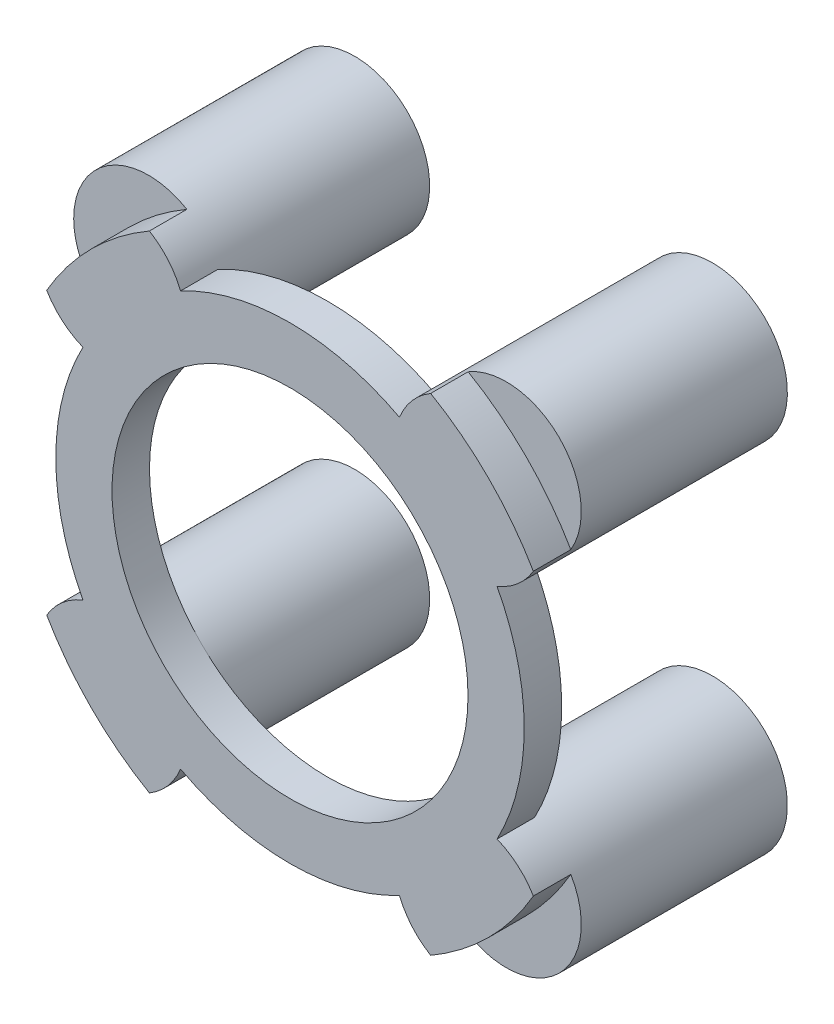
from build123d import *
from build123d.topology import SkipClean

# Parameters (mm, degrees)
SKETCH3_R             = 4
BOSS_EXTRUDE1_DEPTH   = 11
BOSS_EXTRUDE1_2_DEPTH = 11
BOSS_EXTRUDE1_3_DEPTH = 11
BOSS_EXTRUDE1_4_DEPTH = 11
BOSS_EXTRUDE6_START   = 2
SKETCH6_R             = 9.5
BOSS_EXTRUDE6_DEPTH   = 2


with BuildPart() as part:
    # Sketch3 → Boss-Extrude1 (new body)
    with BuildSketch(Plane(origin=(0, 0, 15), x_dir=(-1, 0, 0), z_dir=(0, 0, -1))):
        with Locations((-9.545941546, 9.545941546)):
            Circle(SKETCH3_R)
    extrude(amount=BOSS_EXTRUDE1_DEPTH)



with BuildPart() as body_2:
    # Sketch3 → Boss-Extrude1 2 (new body)
    with BuildSketch(Plane(origin=(0, 0, 15), x_dir=(-1, 0, 0), z_dir=(0, 0, -1))):
        with Locations((9.545941546, 9.545941546)):
            Circle(SKETCH3_R)
    extrude(amount=BOSS_EXTRUDE1_2_DEPTH)


with BuildPart() as body_3:
    # Sketch3 → Boss-Extrude1 3 (new body)
    with BuildSketch(Plane(origin=(0, 0, 15), x_dir=(-1, 0, 0), z_dir=(0, 0, -1))):
        with Locations((9.545941546, -9.545941546)):
            Circle(SKETCH3_R)
    extrude(amount=BOSS_EXTRUDE1_3_DEPTH)


with BuildPart() as body_4:
    # Sketch3 → Boss-Extrude1 4 (new body)
    with BuildSketch(Plane(origin=(0, 0, 15), x_dir=(-1, 0, 0), z_dir=(0, 0, -1))):
        with Locations((-9.545941546, -9.545941546)):
            Circle(SKETCH3_R)
    extrude(amount=BOSS_EXTRUDE1_4_DEPTH)


with BuildPart() as part_1:
    with SkipClean():  # the faces are left unmerged after this step: merging them gives an invalid solid
        add(part.part)

        add(body_2.part)  # Boss-Extrude6 merges body 2

        add(body_3.part)  # Boss-Extrude6 merges body 3

        add(body_4.part)  # Boss-Extrude6 merges body 4
        # Sketch6 → Boss-Extrude6 (add)
        with BuildSketch(Plane.XY.offset(15).offset(BOSS_EXTRUDE6_START)):
            with BuildLine():
                ThreePointArc((-5.840211131, 11.051784197), (-6.514660932, 12.155795534), (-7.506206096, 12.986795988))
                ThreePointArc((-7.506206096, 12.986795988), (-10.606601718, 10.606601718), (-12.986795988, 7.506206096))
                ThreePointArc((-12.986795988, 7.506206096), (-12.155795534, 6.514660932), (-11.051784197, 5.840211131))
                ThreePointArc((-11.051784197, 5.840211131), (-12.5, 0), (-11.051784197, -5.840211131))
                ThreePointArc((-11.051784197, -5.840211131), (-12.155795534, -6.514660932), (-12.986795988, -7.506206096))
                ThreePointArc((-12.986795988, -7.506206096), (-10.606601718, -10.606601718), (-7.506206096, -12.986795988))
                ThreePointArc((-7.506206096, -12.986795988), (-6.514660932, -12.155795534), (-5.840211131, -11.051784197))
                ThreePointArc((-5.840211131, -11.051784197), (0, -12.5), (5.840211131, -11.051784197))
                ThreePointArc((5.840211131, -11.051784197), (6.514660932, -12.155795534), (7.506206096, -12.986795988))
                ThreePointArc((7.506206096, -12.986795988), (10.606601718, -10.606601718), (12.986795988, -7.506206096))
                ThreePointArc((12.986795988, -7.506206096), (12.155795534, -6.514660932), (11.051784197, -5.840211131))
                ThreePointArc((11.051784197, -5.840211131), (12.5, 0), (11.051784197, 5.840211131))
                ThreePointArc((11.051784197, 5.840211131), (12.155795534, 6.514660932), (12.986795988, 7.506206096))
                ThreePointArc((12.986795988, 7.506206096), (10.606601718, 10.606601718), (7.506206096, 12.986795988))
                ThreePointArc((7.506206096, 12.986795988), (6.514660932, 12.155795534), (5.840211131, 11.051784197))
                ThreePointArc((5.840211131, 11.051784197), (0, 12.5), (-5.840211131, 11.051784197))
            make_face()
            Circle(SKETCH6_R, mode=Mode.SUBTRACT)
        extrude(amount=-BOSS_EXTRUDE6_DEPTH)


solid = part_1.part
